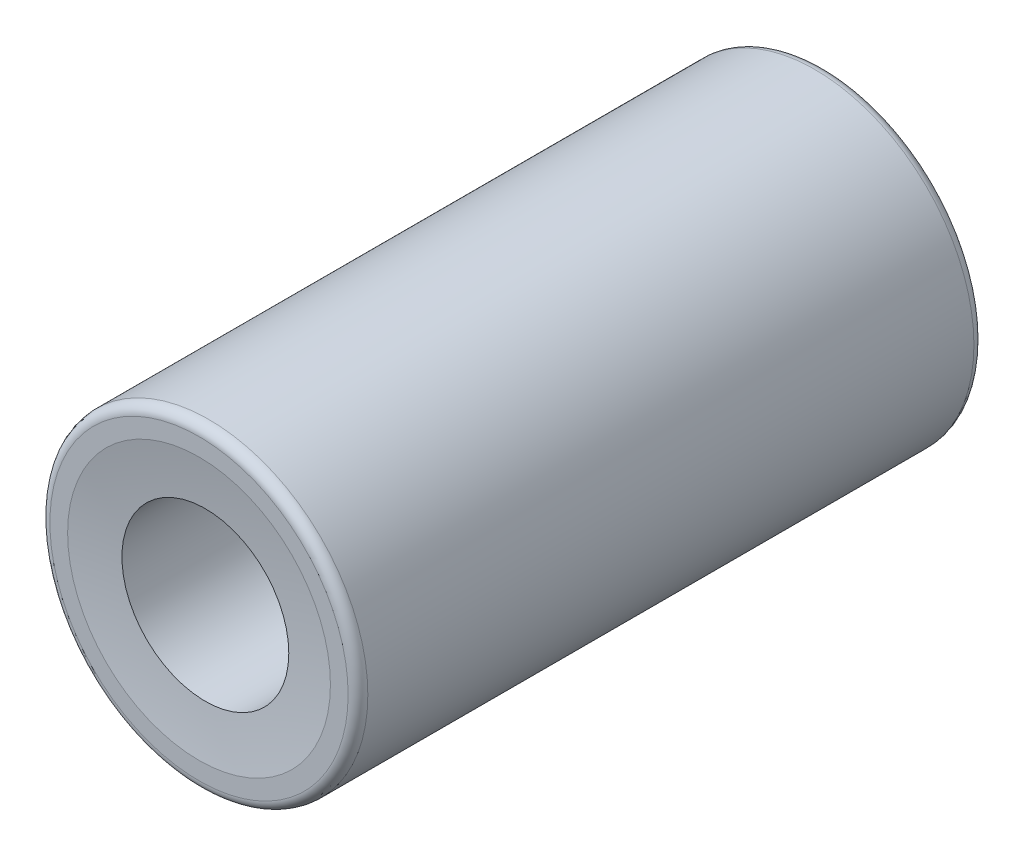
from build123d import *

# Parameters (mm, degrees)
DRAFT1_START       = -9.525
DRAFT1_OUTLINE_R   = 4.838885636
DRAFT1_DEPTH       = 19.05
DRAFT2_ANGLE       = 45
DRAFT3_ANGLE       = 44.810245375
DRAFT4_ANGLE       = 45
DRAFT5_ANGLE       = 45
DRAFT6_ANGLE       = 44.810245375
DRAFT7_ANGLE       = 44.810245375
DRAFT8_ANGLE       = 45
DRAFT9_ANGLE       = 45
DRAFT10_ANGLE      = 45
DRAFT11_ANGLE      = 45
DRAFT12_ANGLE      = 45
FILLET1_R          = 0.0127
CHAMFER1_SIZE      = 0.017960514
FILLET2_R          = 0.3
SKETCH1_R          = 2.54
CUT_EXTRUDE1_DEPTH = 21.241841037


with BuildPart() as part:
    # Draft1: read off the stored shape, not the designer's step
    # Draft1 outline → Draft1 (new body)
    with BuildSketch(Plane.XY.offset(DRAFT1_START)):
        Circle(DRAFT1_OUTLINE_R)
        Polygon((-1.0918, 1.6252), (-0.9521, 1.4855), (-0.9521, 1.6125), (0.9521, 1.6125), (0.9521, 1.4855), (1.0918, 1.6252), (1.168210303, 1.548789697), (1.2315, 1.6125), (1.6125, 1.6125), (1.6125, 1.231499999), (1.485500001, 1.231499999), (1.6252, 1.0918), (1.4855, 0.9521), (1.6125, 0.9521), (1.6125, -0.9521), (1.4855, -0.9521), (1.6252, -1.0918), (1.485500001, -1.231499999), (1.612499999, -1.231499999), (1.6125, -1.6125), (1.2315, -1.6125), (1.2315, -1.4855), (1.0918, -1.6252), (0.9521, -1.4855), (0.9521, -1.6125), (-0.9521, -1.6125), (-0.9521, -1.4855), (-1.0918, -1.6252), (-1.2315, -1.4855), (-1.2315, -1.6125), (-1.6125, -1.6125), (-1.6125, -1.231499999), (-1.485500001, -1.231499999), (-1.6252, -1.0918), (-1.4855, -0.9521), (-1.6125, -0.9521), (-1.6125, 0.9521), (-1.4855, 0.9521), (-1.6252, 1.0918), (-1.485500001, 1.231499999), (-1.612499999, 1.231499999), (-1.6125, 1.6125), (-1.2315, 1.6125), (-1.2315, 1.4855), align=None, mode=Mode.SUBTRACT)
    extrude(amount=DRAFT1_DEPTH)

    # Draft1 2 outline → Draft1 2 (revolve, cut)
    with BuildSketch(Plane.XZ):
        with BuildLine():
            Line((1.6125, -9.525), (4, -9.525))
            ThreePointArc((4, -9.525), (2.809495756, -9.361292288), (1.6125, -9.254982683))
            Line((1.6125, -9.254982683), (1.6125, -9.525))
        make_face()
        with BuildLine():
            Line((1.6125, 9.525), (1.6125, 9.254982683))
            ThreePointArc((1.6125, 9.254982683), (2.809495756, 9.361292288), (4, 9.525))
            Line((4, 9.525), (1.6125, 9.525))
        make_face()
    revolve(axis=Axis((0, 0, 0), (0, 0, 1)), mode=Mode.SUBTRACT)

    # Draft2
    draft2_faces = [part.faces().sort_by_distance(p)[0] for p in [
        (1.549009001, 1.231499999, 0),
    ]]
    draft(draft2_faces, Plane(origin=(1.6125, -1.6125, 11.43), x_dir=(0, 0, -1), z_dir=(-1, 0, 0)), DRAFT2_ANGLE)

    # Draft3
    draft3_faces = [part.faces().sort_by_distance(p)[0] for p in [
        (1.549009001, -1.231499999, 0),
    ]]
    draft(draft3_faces, Plane(origin=(1.6125, -1.6125, 11.43), x_dir=(0, 0, -1), z_dir=(-1, 0, 0)), DRAFT3_ANGLE)

    # Draft4
    draft4_faces = [part.faces().sort_by_distance(p)[0] for p in [
        (1.2315, -1.549009001, 0),
    ]]
    draft(draft4_faces, Plane(origin=(-1.6125, -1.6125, 11.43), x_dir=(0, 0, 1), z_dir=(0, 1, 0)), DRAFT4_ANGLE)

    # Draft5
    draft5_faces = [part.faces().sort_by_distance(p)[0] for p in [
        (-1.2315, 1.549009001, 0),
    ]]
    draft(draft5_faces, Plane(origin=(1.6125, 1.6125, 11.43), x_dir=(0, 0, -1), z_dir=(0, -1, 0)), DRAFT5_ANGLE)

    # Draft6
    draft6_faces = [part.faces().sort_by_distance(p)[0] for p in [
        (-1.549009001, 1.231499999, 0),
    ]]
    draft(draft6_faces, Plane(origin=(-1.6125, 1.6125, 11.43), x_dir=(0, 0, 1), z_dir=(1, 0, 0)), DRAFT6_ANGLE)

    # Draft7
    draft7_faces = [part.faces().sort_by_distance(p)[0] for p in [
        (-1.2315, -1.549009001, 0),
    ]]
    draft(draft7_faces, Plane(origin=(-1.6125, -1.6125, 11.43), x_dir=(0, 0, 1), z_dir=(0, 1, 0)), DRAFT7_ANGLE)

    # Draft8
    draft8_faces = [part.faces().sort_by_distance(p)[0] for p in [
        (-1.549009001, -1.231499999, 0),
    ]]
    draft(draft8_faces, Plane(origin=(-1.6125, 1.6125, 11.43), x_dir=(0, 0, 1), z_dir=(1, 0, 0)), DRAFT8_ANGLE)

    # Draft9
    draft9_faces = [part.faces().sort_by_distance(p)[0] for p in [
        (-0.9521, 1.549009008, 0),
        (0.9521, 1.549009008, 0),
    ]]
    draft(draft9_faces, Plane(origin=(1.6125, 1.6125, 11.43), x_dir=(0, 0, -1), z_dir=(0, -1, 0)), DRAFT9_ANGLE)

    # Draft10
    draft10_faces = [part.faces().sort_by_distance(p)[0] for p in [
        (1.549009008, -0.9521, 0),
        (1.549009008, 0.9521, 0),
    ]]
    draft(draft10_faces, Plane(origin=(1.6125, -1.6125, 11.43), x_dir=(0, 0, -1), z_dir=(-1, 0, 0)), DRAFT10_ANGLE)

    # Draft11
    draft11_faces = [part.faces().sort_by_distance(p)[0] for p in [
        (-0.9521, -1.549009008, 0),
        (0.9521, -1.549009008, 0),
    ]]
    draft(draft11_faces, Plane(origin=(-1.6125, -1.6125, 11.43), x_dir=(0, 0, 1), z_dir=(0, 1, 0)), DRAFT11_ANGLE)

    # Draft12
    draft12_faces = [part.faces().sort_by_distance(p)[0] for p in [
        (-1.549009008, 0.9521, 0),
        (-1.549009008, -0.9521, 0),
    ]]
    draft(draft12_faces, Plane(origin=(-1.6125, 1.6125, 11.43), x_dir=(0, 0, 1), z_dir=(1, 0, 0)), DRAFT12_ANGLE)

    # Fillet1
    fillet1_edges = [part.edges().sort_by_distance(p)[0] for p in [
        (-1.0156, 1.549, 0),
        (-1.168, 1.549, 0),
        (-1.548789698, 1.168210302, 0),
        (-1.549, 1.0156, 0),
        (-1.549, -1.0156, 0),
        (-1.549, -1.168, 0),
        (-1.168210303, -1.548789697, 0),
        (-1.0156, -1.549, 0),
        (1.0156, -1.549, 0),
        (1.168, -1.549, 0),
        (1.548789698, -1.168210302, 0),
        (1.549, -1.0156, 0),
        (1.549, 1.0156, 0),
        (1.549, 1.168, 0),
        (1.168210303, 1.548789697, 0),
        (1.0156, 1.549, 0),
    ]]
    fillet(fillet1_edges, radius=FILLET1_R)

    # Chamfer1
    chamfer1_edges = [part.edges().sort_by_distance(p)[0] for p in [
        (-1.0918, 1.6252, 0),
        (-1.6252, 1.0918, 0),
        (-1.6252, -1.0918, 0),
        (1.6252, -1.0918, 0),
        (1.6252, 1.0918, 0),
        (1.0918, 1.6252, 0),
    ]]
    chamfer(chamfer1_edges, length=CHAMFER1_SIZE)

    # Fillet2
    fillet2_edges = [part.edges().sort_by_distance(p)[0] for p in [
        (-4.838885636, 0, 9.525),
        (-4.838885636, 0, -9.525),
        (-1.6125, 1.6125, 0),
        (-1.6125, -1.6125, 0),
        (1.6125, -1.6125, 0),
        (1.6125, 1.6125, 0),
    ]]
    fillet(fillet2_edges, radius=FILLET2_R)

    # Sketch1 → Cut-Extrude1 (cut, through all)
    with BuildSketch(Plane.XY.offset(9.525)):
        Circle(SKETCH1_R)
    extrude(amount=-CUT_EXTRUDE1_DEPTH, mode=Mode.SUBTRACT)


solid = part.part
